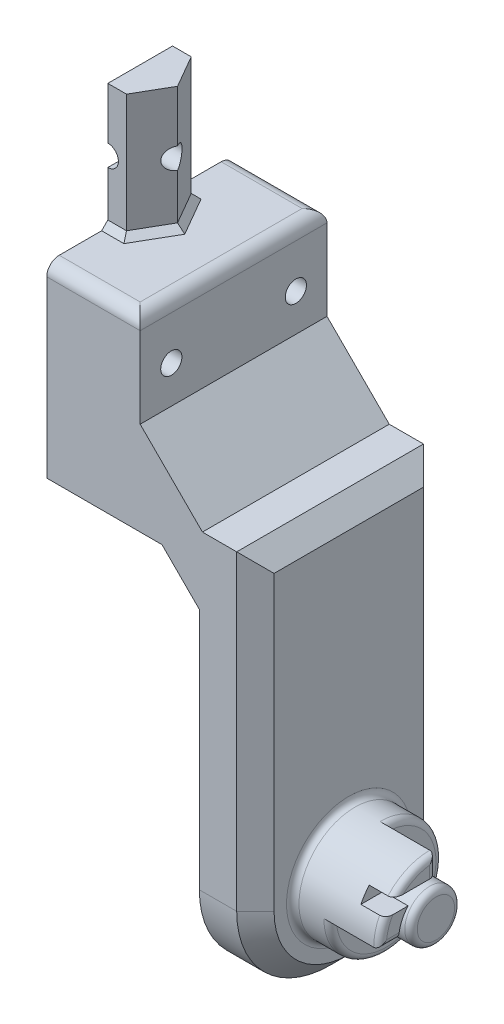
from build123d import *

# Parameters (mm, degrees)
BOSS_EXTRUDE1_DEPTH  = 12
SKETCH2_R            = 9
BOSS_EXTRUDE2_DEPTH  = 6
SKETCH3_R            = 4
BOSS_EXTRUDE7_DEPTH  = 8
BOSS_EXTRUDE8_START  = -8
BOSS_EXTRUDE8_DEPTH  = 8
BOSS_EXTRUDE9_START  = -8
BOSS_EXTRUDE9_DEPTH  = 4
BOSS_EXTRUDE11_DEPTH = 21.5
BOSS_EXTRUDE12_DEPTH = 25
CHAMFER1_SIZE        = 10
SKETCH8_R            = 1.7000000000000015
CUT_EXTRUDE1_DEPTH   = 84.10385069297331
CHAMFER2_SIZE        = 3
FILLET1_R            = 2
FILLET2_R            = 1
BOSS_EXTRUDE13_DEPTH = 20
CUT_EXTRUDE2_DEPTH   = 101.54294892174786
SKETCH11_R           = 1.7000000000000037
CUT_EXTRUDE3_DEPTH   = 105.74850838221995
CHAMFER3_SIZE        = 1
CUT_EXTRUDE5_DEPTH   = 15
CHAMFER4_SIZE        = 1
FILLET3_R            = 1


with BuildPart() as part:
    # Sketch1 → Boss-Extrude1 (new body)
    with BuildSketch(Plane(origin=(0, 0, 0), x_dir=(0, 0, -1), z_dir=(1, 0, 0))):
        with BuildLine():
            Line((-15, 0), (-15, 50))
            Line((-15, 50), (15, 50))
            Line((15, 50), (15, 0))
            ThreePointArc((15, 0), (-2.76e-15, -15), (-15, 0))
        make_face()
    extrude(amount=BOSS_EXTRUDE1_DEPTH)

    # Sketch2 → Boss-Extrude2 (add)
    with BuildSketch(Plane(origin=(12, 0, 0), x_dir=(0, 0, -1), z_dir=(1, 0, 0))):
        Circle(SKETCH2_R)
    extrude(amount=BOSS_EXTRUDE2_DEPTH)

    # Sketch3 → Boss-Extrude7 (add)
    with BuildSketch(Plane(origin=(18.000000000000004, 0, 0), x_dir=(0, 0, -1), z_dir=(1, 0, 0))):
        Circle(SKETCH3_R)
    extrude(amount=BOSS_EXTRUDE7_DEPTH)

    # Sketch5 → Boss-Extrude8 (add)
    with BuildSketch(Plane(origin=(26.000000000000004, 0, 0), x_dir=(0, 0, -1), z_dir=(1, 0, 0)).offset(BOSS_EXTRUDE8_START)):
        with BuildLine():
            Line((-9, 0), (-6.000000000000001, 0))
            ThreePointArc((-6.000000000000001, 7.3e-16), (-5.605034153776295, 2.140932538638541), (-4.4721359549995805, 3.9999999999999996))
            Line((-4.472135954999581, 4), (-8.06225774829855, 4))
            ThreePointArc((-8.062257748298551, 4), (-8.762428879445668, 2.054224946946299), (-9, 1.1e-16))
        make_face()
        with BuildLine():
            Line((-6.708203932499368, 6), (0, 6))
            Line((0, 6), (0, 9))
            ThreePointArc((0, 9), (-3.6742346141747673, 8.215838362577493), (-6.7082039324993685, 6.000000000000003))
        make_face()
    extrude(amount=BOSS_EXTRUDE8_DEPTH)

    # Sketch5<3> → Boss-Extrude9 (add)
    with BuildSketch(Plane(origin=(26.000000000000004, 0, 0), x_dir=(0, 0, -1), z_dir=(1, 0, 0)).offset(BOSS_EXTRUDE9_START)):
        with BuildLine():
            Line((-8.06225774829855, 4), (-4.472135954999581, 4))
            ThreePointArc((-4.4721359549995805, 3.9999999999999996), (-2.4494897427831788, 5.477225575051661), (3.7e-16, 6.000000000000001))
            Line((0, 6), (-6.708203932499368, 6))
            ThreePointArc((-6.7082039324993685, 6.000000000000003), (-7.452626018121394, 5.045628348780764), (-8.062257748298551, 4))
        make_face()
    extrude(amount=BOSS_EXTRUDE9_DEPTH)

    # Sketch6 → Boss-Extrude11 (add)
    with BuildSketch(Plane.ZY):
        Polygon((-15, 50), (15, 50), (15, 42), (-14.999999999999998, 42), align=None)
    extrude(amount=BOSS_EXTRUDE11_DEPTH)

    # Sketch7 → Boss-Extrude12 (add)
    with BuildSketch(Plane(origin=(0, 50, 0), x_dir=(1, 0, 0), z_dir=(0, 1, 0))):
        Polygon((-21.5, 15), (-6.499999999999999, 15), (-6.499999999999996, -15), (-21.5, -15), align=None)
    extrude(amount=BOSS_EXTRUDE12_DEPTH)

    # Chamfer1
    chamfer1_edges = [part.edges().sort_by_distance(p)[0] for p in [
        (-6.499999999999997, 50, 0),
    ]]
    chamfer(chamfer1_edges, length=CHAMFER1_SIZE)

    # Sketch8 → Cut-Extrude1 (cut, through all)
    with BuildSketch(Plane(origin=(-6.499999999999997, 0, 7.5e-16), x_dir=(-1.2e-16, 0, -1), z_dir=(1, 0, -1.2e-16))):
        with Locations((-9.999999999999998, 66.00000000000007)):
            Circle(SKETCH8_R)
        with Locations((9.999999999999998, 66.00000000000007)):
            Circle(SKETCH8_R)
    extrude(amount=-CUT_EXTRUDE1_DEPTH, mode=Mode.SUBTRACT)

    # Chamfer2
    chamfer2_edges = [part.edges().sort_by_distance(p)[0] for p in [
        (0, -14.999999999999998, -2.03e-15),
        (-10.75, 42, -14.999999999999998),
        (0, 21, -15),
        (0, 21, 15),
        (0, 42, 0),
        (-10.75, 42, 15),
        (12, -14.999999999999998, -2.03e-15),
        (12, 25, -15),
        (12, 25, 15),
        (12, 50, 0),
    ]]
    chamfer(chamfer2_edges, length=CHAMFER2_SIZE)

    # Fillet1
    fillet1_edges = [part.edges().sort_by_distance(p)[0] for p in [
        (-14, 75, -15),
        (-6.499999999999997, 75, 0),
        (-13.999999999999996, 75, 15),
    ]]
    fillet(fillet1_edges, radius=FILLET1_R)

    # Fillet2
    fillet2_edges = [part.edges().sort_by_distance(p)[0] for p in [
        (26.000000000000004, 3.8e-16, 4),
        (18, -9, 1.65e-15),
        (12, 1.1e-15, 9),
    ]]
    fillet(fillet2_edges, radius=FILLET2_R)

    # Sketch9 → Boss-Extrude13 (add)
    with BuildSketch(Plane(origin=(0, 75.00000000000001, 0), x_dir=(1, 0, 0), z_dir=(0, 1, 0))):
        Polygon((-15.500000000000007, -1.041e-14), (-18.500000000000004, 5.1961524227066205), (-21.5, 5.1961524227066205), (-21.5, -5.196152422706621), (-18.5, -5.196152422706619), align=None)
    extrude(amount=BOSS_EXTRUDE13_DEPTH)

    # Sketch10 → Cut-Extrude2 (cut, through all)
    with BuildSketch(Plane.XY.offset(5.196152422706602)):
        with BuildLine():
            Line((-21.5, 86.70000000000002), (-21.5, 83.30000000000003))
            ThreePointArc((-21.5, 83.30000000000003), (-19.80000000000001, 85.00000000000001), (-21.5, 86.70000000000002))
        make_face()
    extrude(amount=-CUT_EXTRUDE2_DEPTH, mode=Mode.SUBTRACT)

    # Sketch11 → Cut-Extrude3 (cut, through all)
    with BuildSketch(Plane(origin=(-15.500000000000007, 0, 1.79e-15), x_dir=(-1.2e-16, 0, -1), z_dir=(1, 0, -1.2e-16))):
        with Locations((-8.62e-15, 85.00000000000001)):
            Circle(SKETCH11_R)
    extrude(amount=-CUT_EXTRUDE3_DEPTH, mode=Mode.SUBTRACT)

    # Chamfer3
    chamfer3_edges = [part.edges().sort_by_distance(p)[0] for p in [
        (-20, 75.00000000000001, -5.1961524227066205),
        (-17.000000000000007, 75.00000000000001, -2.5980762113533054),
        (-20, 75.00000000000001, 5.19615242270662),
        (-17.000000000000004, 75.00000000000001, 2.5980762113533147),
    ]]
    chamfer(chamfer3_edges, length=CHAMFER3_SIZE)

    # Sketch12 → Cut-Extrude5 (cut)
    with BuildSketch(Plane.ZY):
        Polygon((6.200000000000001, 8.7e-16), (3.100000000000001, 5.369357503463521), (-3.100000000000001, 5.369357503463522), (-6.200000000000002, 1.74e-15), (-3.100000000000001, -5.3693575034635215), (3.0999999999999996, -5.369357503463523), align=None)
    extrude(amount=-CUT_EXTRUDE5_DEPTH, mode=Mode.SUBTRACT)

    # Chamfer4
    chamfer4_edges = [part.edges().sort_by_distance(p)[0] for p in [
        (0, -5.369357503463522, -4.4e-16),
        (0, -2.68467875173176, -4.650000000000001),
        (0, -2.684678751731761, 4.65),
        (0, 2.6846787517317607, 4.650000000000001),
        (0, 2.684678751731762, -4.650000000000002),
        (0, 5.3693575034635215, 0),
    ]]
    chamfer(chamfer4_edges, length=CHAMFER4_SIZE)

    # Fillet3
    fillet3_edges = [part.edges().sort_by_distance(p)[0] for p in [
        (26.000000000000004, 0, 7.5),
        (26.000000000000004, 7.5, 0),
        (26.000000000000004, 2.054224946946299, 8.762428879445668),
        (26.000000000000004, 8.215838362577493, 3.674234614174768),
    ]]
    fillet(fillet3_edges, radius=FILLET3_R)


solid = part.part
